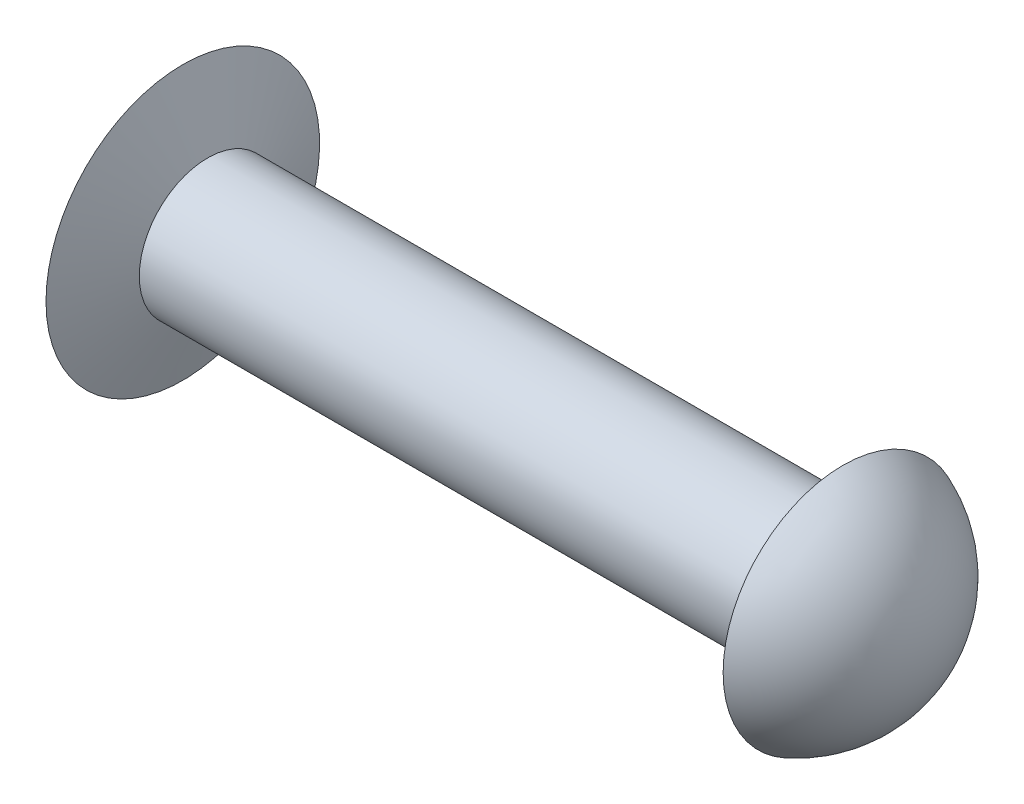
from build123d import *


with BuildPart() as part:
    # Sketch1 → Base-Revolve (revolve)
    with BuildSketch(Plane.XY):
        with BuildLine():
            Line((-30.950769237, 0), (0, 0))
            Line((0, 0), (0, 3))
            Line((0, 3), (-27.858858534, 3))
            Line((-27.858858534, 3), (-28.950769237, 6))
            ThreePointArc((-28.950769237, 6), (-30.437602218, 3.16227766), (-30.950769237, 0))
        make_face()
    revolve(axis=Axis((-39, 0, 0), (1, 0, 0)))

    # Sketch2 → HeadTypeA (revolve)
    with BuildSketch(Plane.XY):
        with BuildLine():
            Line((0, 0), (3.6, 0))
            ThreePointArc((3.6, 0), (2.613552069, 3.182864276), (0, 5.25))
            Line((0, 5.25), (0, 0))
        make_face()
    revolve(axis=Axis((-49, 0, 0), (1, 0, 0)))


solid = part.part
